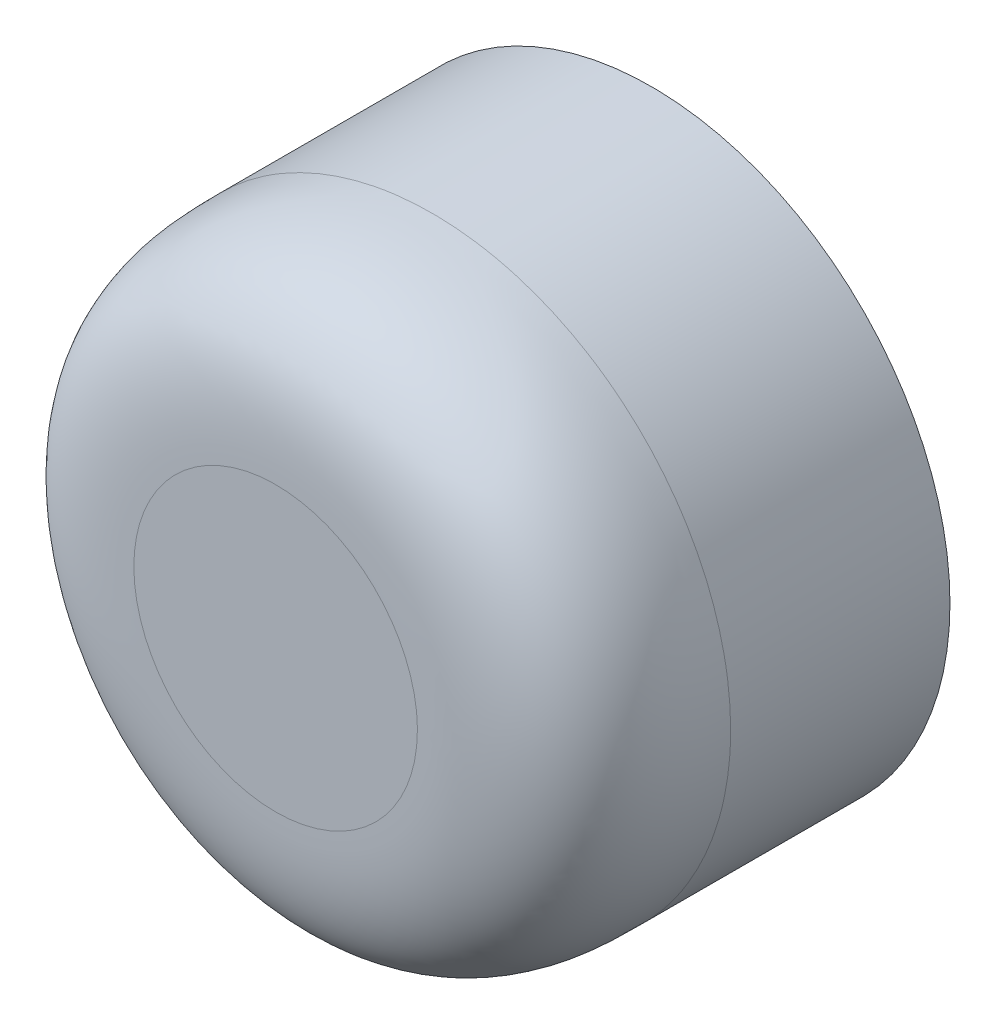
from build123d import *

# Parameters (mm, degrees)
SKETCH1_R           = 9.525
BOSS_EXTRUDE1_DEPTH = 12
FILLET1_SIZE        = 5


with BuildPart() as part:
    # Sketch1 → Boss-Extrude1 (new body)
    with BuildSketch(Plane.XY):
        Circle(SKETCH1_R)
    extrude(amount=BOSS_EXTRUDE1_DEPTH)

    # Fillet1
    # a fillet whose section is not a circle: 5 mm, written as the material it takes off along each edge
    with BuildSketch(Plane(origin=(0, 0, 12), x_dir=(1, 0, 0), z_dir=(0, -1, 0))) as fillet1_piece_1:
        with BuildLine():
            add(Edge.make_bspline([(9.525, -FILLET1_SIZE), (9.525, -FILLET1_SIZE * 0.831801948466), (9.525, -FILLET1_SIZE * 0.663603896932), (9.525 - FILLET1_SIZE * 0.0716919198361, -FILLET1_SIZE * 0.292893218813), (9.525 - FILLET1_SIZE * 0.292893218813, -FILLET1_SIZE * 0.0716919198361), (9.525 - FILLET1_SIZE * 0.663603896932, 0), (9.525 - FILLET1_SIZE * 0.831801948466, 0), (9.525 - FILLET1_SIZE, 0)], knots=[0, 0, 0, 0, 0, 0, 0.5, 0.5, 1, 1, 1, 1, 1, 1], degree=5))
            Line((9.525 - FILLET1_SIZE, 0), (9.525, 0))
            Line((9.525, 0), (9.525, -FILLET1_SIZE))
        make_face()
    revolve(axis=Axis((0, 0, 12), (0, 0, 1)), mode=Mode.SUBTRACT)


solid = part.part
